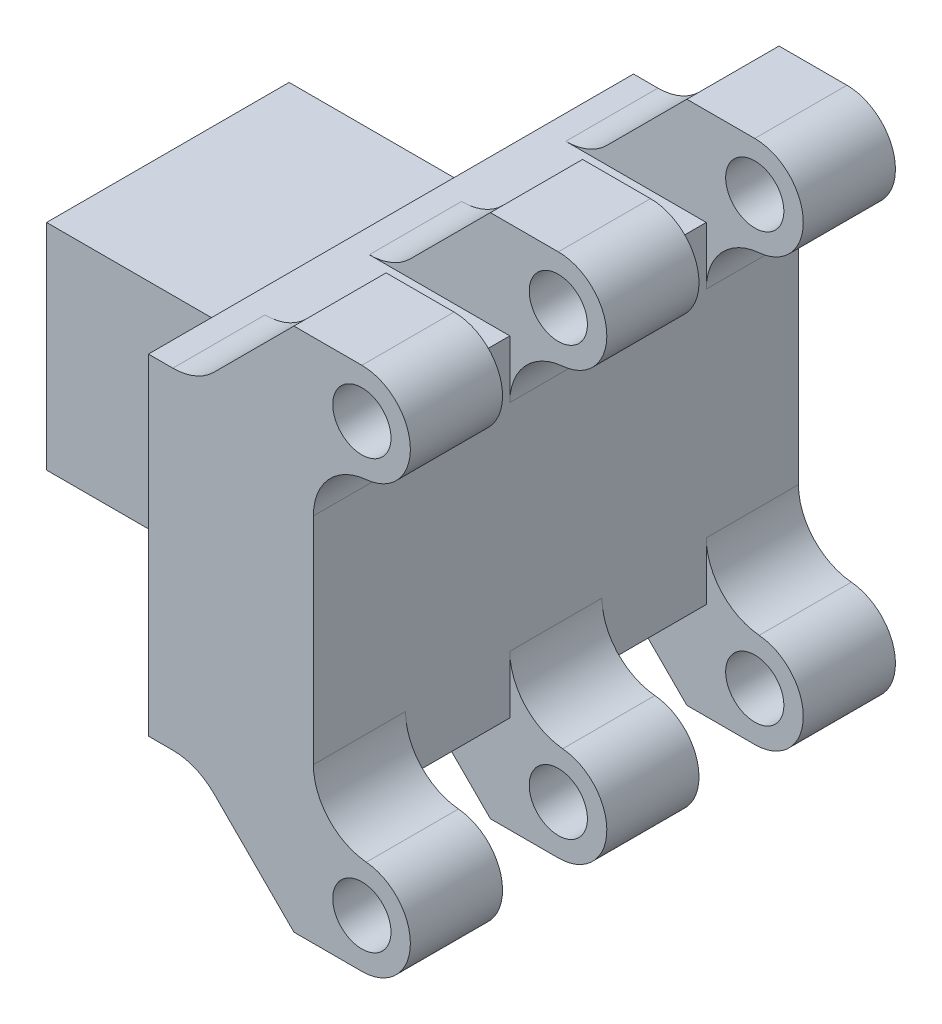
from build123d import *

# Parameters (mm, degrees)
SKETCH1_W               = 50
SKETCH1_H               = 34.11
BOSS_EXTRUDE1_DEPTH     = 20
SKETCH2_R               = 3
BOSS_EXTRUDE2_DEPTH     = 9.5
LPATTERN1_COUNT         = 3
LPATTERN1_PITCH         = 20.25
MIRROR1_COPY_1_SKETCH_R = 3
MIRROR1_COPY_1_DEPTH    = 9.5
MIRROR1_COPY_2_SKETCH_R = 3
MIRROR1_COPY_2_DEPTH    = 9.5
SKETCH3_R               = 8
SKETCH3_W               = 3
SKETCH3_H               = 30
CUT_EXTRUDE1_DEPTH      = 10
SKETCH4_W               = 42
SKETCH4_H               = 22.11
CUT_EXTRUDE2_DEPTH      = 3
FILLET1_R               = 6
FILLET2_R               = 6
BOSS_EXTRUDE3_START     = 20
SKETCH5_W               = 25
SKETCH5_H               = 22.11
SKETCH5_R               = 8
BOSS_EXTRUDE3_DEPTH     = 20


with BuildPart() as part:
    # Sketch1 → Boss-Extrude1 (new body)
    with BuildSketch(Plane(origin=(0, 0, 0), x_dir=(0, 0, -1), z_dir=(1, 0, 0))):
        with Locations((25, 17.055)):
            Rectangle(SKETCH1_W, SKETCH1_H)
    extrude(amount=BOSS_EXTRUDE1_DEPTH)

    # Sketch2 → Boss-Extrude2 (add)
    with BuildSketch(Plane.XY):
        with BuildLine():
            Line((20, 34.11), (25, 34.11))
            ThreePointArc((25, 34.11), (30, 39.11), (25, 44.11))
            Line((25, 44.11), (18, 44.11))
            Line((18, 44.11), (8, 34.11))
            Line((8, 34.11), (20, 34.11))
        make_face()
        with Locations((25, 39.11)):
            Circle(SKETCH2_R, mode=Mode.SUBTRACT)
    boss_extrude2 = extrude(amount=-BOSS_EXTRUDE2_DEPTH)

    # LPattern1: Boss-Extrude2 ×3
    with Locations(*[(0, 0, -i * LPATTERN1_PITCH) for i in range(1, LPATTERN1_COUNT)]):
        add(boss_extrude2)

    # Mirror1: Boss-Extrude2 across plane
    add(boss_extrude2.mirror(Plane.ZX.offset(17.055)))

    # Mirror1 copy 1 sketch → Mirror1 copy 1 (add)
    with BuildSketch(Plane(origin=(0, 34.11, -20.25), x_dir=(1, 0, 0), z_dir=(0, 0, 1))):
        with BuildLine():
            Line((20, -34.11), (25, -34.11))
            ThreePointArc((25, -34.11), (30, -39.11), (25, -44.11))
            Line((25, -44.11), (18, -44.11))
            Line((18, -44.11), (8, -34.11))
            Line((8, -34.11), (20, -34.11))
        make_face()
        with Locations((25, -39.11)):
            Circle(MIRROR1_COPY_1_SKETCH_R, mode=Mode.SUBTRACT)
    extrude(amount=-MIRROR1_COPY_1_DEPTH)

    # Mirror1 copy 2 sketch → Mirror1 copy 2 (add)
    with BuildSketch(Plane(origin=(0, 34.11, -40.5), x_dir=(1, 0, 0), z_dir=(0, 0, 1))):
        with BuildLine():
            Line((20, -34.11), (25, -34.11))
            ThreePointArc((25, -34.11), (30, -39.11), (25, -44.11))
            Line((25, -44.11), (18, -44.11))
            Line((18, -44.11), (8, -34.11))
            Line((8, -34.11), (20, -34.11))
        make_face()
        with Locations((25, -39.11)):
            Circle(MIRROR1_COPY_2_SKETCH_R, mode=Mode.SUBTRACT)
    extrude(amount=-MIRROR1_COPY_2_DEPTH)

    # Sketch3 → Cut-Extrude1 (cut)
    with BuildSketch(Plane.ZY):
        with Locations((-25, 17.055)):
            Circle(SKETCH3_R)
        with Locations((-39, 17.055)):
            Rectangle(SKETCH3_W, SKETCH3_H)
        with Locations((-11, 17.055)):
            Rectangle(SKETCH3_W, SKETCH3_H)
    extrude(amount=-CUT_EXTRUDE1_DEPTH, mode=Mode.SUBTRACT)

    # Sketch4 → Cut-Extrude2 (cut)
    with BuildSketch(Plane(origin=(0, 0, 0), x_dir=(0, 0, -1), z_dir=(1, 0, 0))):
        Polygon((50, 34.11), (0, 34.11), (0, 28.11), (0, 6), (0, 0), (50, 0), (50, 6), (50, 28.11), align=None)
        with Locations((25, 17.055)):
            Rectangle(SKETCH4_W, SKETCH4_H, mode=Mode.SUBTRACT)
    extrude(amount=CUT_EXTRUDE2_DEPTH, mode=Mode.SUBTRACT)

    # Fillet1
    # the kernel refuses this fillet: 6 mm, written as the material it adds along each edge
    with BuildSketch(Plane(origin=(20, 0, -25.613872125), x_dir=(0, 1, 0), z_dir=(0, 0, -1))) as fillet1_piece_1_section:
        with BuildLine():
            CenterArc((5.95445115, 6), FILLET1_R, 185.21590857, 84.78409143)
            Line((-0.020704023, 5.454545455), (-0.61821954, 5.4))
            ThreePointArc((-0.61821954, 5.4), (-0.6, 5), (-0.6, 0))
            Line((-0.6, 0), (0, -0.6))
            Line((0, -0.6), (5.95445115, -0.6))
            Line((5.95445115, -0.6), (5.95445115, 0))
        make_face()
    fillet1_piece_1 = extrude(amount=39.272255751, mode=Mode.PRIVATE)
    fillet1_piece_1 = split(fillet1_piece_1, bisect_by=Plane(origin=(21.495039794, 1.973310918, -29.75), z_dir=(0, 0, 1)), keep=Keep.TOP, mode=Mode.PRIVATE)
    add(fillet1_piece_1)
    with BuildSketch(Plane(origin=(20, 0, -40.5), x_dir=(0, 1, 0), z_dir=(0, 0, -1)), Plane(origin=(20, 0, -20.25), x_dir=(0, 1, 0), z_dir=(0, 0, -1)), Plane(origin=(20, 0, 0), x_dir=(0, 1, 0), z_dir=(0, 0, -1)), Plane(origin=(20, 34.11, -50), x_dir=(0, -1, 0), z_dir=(0, 0, 1)), Plane(origin=(20, 34.11, -29.75), x_dir=(0, -1, 0), z_dir=(0, 0, 1)), Plane(origin=(20, 34.11, -9.5), x_dir=(0, -1, 0), z_dir=(0, 0, 1))) as fillet1_piece_2:
        with BuildLine():
            CenterArc((5.95445115, 6), FILLET1_R, 185.21590857, 84.78409143)
            Line((-0.020704023, 5.454545455), (-0.61821954, 5.4))
            ThreePointArc((-0.61821954, 5.4), (-0.6, 5), (-0.6, 0))
            Line((-0.6, 0), (0, -0.6))
            Line((0, -0.6), (5.95445115, -0.6))
            Line((5.95445115, -0.6), (5.95445115, 0))
        make_face()
    extrude(amount=9.5)
    with BuildSketch(Plane(origin=(20, 0, -5.363872125), x_dir=(0, 1, 0), z_dir=(0, 0, -1))) as fillet1_piece_3_section:
        with BuildLine():
            CenterArc((5.95445115, 6), FILLET1_R, 185.21590857, 84.78409143)
            Line((-0.020704023, 5.454545455), (-0.61821954, 5.4))
            ThreePointArc((-0.61821954, 5.4), (-0.6, 5), (-0.6, 0))
            Line((-0.6, 0), (0, -0.6))
            Line((0, -0.6), (5.95445115, -0.6))
            Line((5.95445115, -0.6), (5.95445115, 0))
        make_face()
    fillet1_piece_3 = extrude(amount=39.272255751, mode=Mode.PRIVATE)
    fillet1_piece_3 = split(fillet1_piece_3, bisect_by=Plane(origin=(21.495039794, 1.973310918, -9.5), z_dir=(0, 0, 1)), keep=Keep.TOP, mode=Mode.PRIVATE)
    add(fillet1_piece_3)
    with BuildSketch(Plane(origin=(20, 0, -5.363872125), x_dir=(0, 1, 0), z_dir=(0, 0, -1))) as fillet1_piece_4_section:
        with BuildLine():
            CenterArc((5.95445115, 6), FILLET1_R, 185.21590857, 84.78409143)
            Line((-0.020704023, 5.454545455), (-0.61821954, 5.4))
            ThreePointArc((-0.61821954, 5.4), (-0.6, 5), (-0.6, 0))
            Line((-0.6, 0), (0, -0.6))
            Line((0, -0.6), (5.95445115, -0.6))
            Line((5.95445115, -0.6), (5.95445115, 0))
        make_face()
    fillet1_piece_4 = extrude(amount=39.272255751, mode=Mode.PRIVATE)
    fillet1_piece_4 = split(fillet1_piece_4, bisect_by=Plane(origin=(21.495039794, 1.973310918, -40.5), z_dir=(0, 0, -1)), keep=Keep.TOP, mode=Mode.PRIVATE)
    add(fillet1_piece_4)
    with BuildSketch(Plane(origin=(20, 0, 14.886127875), x_dir=(0, 1, 0), z_dir=(0, 0, -1))) as fillet1_piece_5_section:
        with BuildLine():
            CenterArc((5.95445115, 6), FILLET1_R, 185.21590857, 84.78409143)
            Line((-0.020704023, 5.454545455), (-0.61821954, 5.4))
            ThreePointArc((-0.61821954, 5.4), (-0.6, 5), (-0.6, 0))
            Line((-0.6, 0), (0, -0.6))
            Line((0, -0.6), (5.95445115, -0.6))
            Line((5.95445115, -0.6), (5.95445115, 0))
        make_face()
    fillet1_piece_5 = extrude(amount=39.272255751, mode=Mode.PRIVATE)
    fillet1_piece_5 = split(fillet1_piece_5, bisect_by=Plane(origin=(21.495039794, 1.973310918, -20.25), z_dir=(0, 0, -1)), keep=Keep.TOP, mode=Mode.PRIVATE)
    add(fillet1_piece_5)
    with BuildSketch(Plane(origin=(20, 34.11, -64.886127875), x_dir=(0, -1, 0), z_dir=(0, 0, 1))) as fillet1_piece_6_section:
        with BuildLine():
            CenterArc((5.95445115, 6), FILLET1_R, 185.21590857, 84.78409143)
            Line((-0.020704023, 5.454545455), (-0.61821954, 5.4))
            ThreePointArc((-0.61821954, 5.4), (-0.6, 5), (-0.6, 0))
            Line((-0.6, 0), (0, -0.6))
            Line((0, -0.6), (5.95445115, -0.6))
            Line((5.95445115, -0.6), (5.95445115, 0))
        make_face()
    fillet1_piece_6 = extrude(amount=39.272255751, mode=Mode.PRIVATE)
    fillet1_piece_6 = split(fillet1_piece_6, bisect_by=Plane(origin=(21.495039794, 32.136689082, -29.75), z_dir=(0, 0, 1)), keep=Keep.TOP, mode=Mode.PRIVATE)
    add(fillet1_piece_6)
    with BuildSketch(Plane(origin=(20, 34.11, -44.636127875), x_dir=(0, -1, 0), z_dir=(0, 0, 1))) as fillet1_piece_7_section:
        with BuildLine():
            CenterArc((5.95445115, 6), FILLET1_R, 185.21590857, 84.78409143)
            Line((-0.020704023, 5.454545455), (-0.61821954, 5.4))
            ThreePointArc((-0.61821954, 5.4), (-0.6, 5), (-0.6, 0))
            Line((-0.6, 0), (0, -0.6))
            Line((0, -0.6), (5.95445115, -0.6))
            Line((5.95445115, -0.6), (5.95445115, 0))
        make_face()
    fillet1_piece_7 = extrude(amount=39.272255751, mode=Mode.PRIVATE)
    fillet1_piece_7 = split(fillet1_piece_7, bisect_by=Plane(origin=(21.495039794, 32.136689082, -40.5), z_dir=(0, 0, -1)), keep=Keep.TOP, mode=Mode.PRIVATE)
    add(fillet1_piece_7)
    with BuildSketch(Plane(origin=(20, 34.11, -44.636127875), x_dir=(0, -1, 0), z_dir=(0, 0, 1))) as fillet1_piece_8_section:
        with BuildLine():
            CenterArc((5.95445115, 6), FILLET1_R, 185.21590857, 84.78409143)
            Line((-0.020704023, 5.454545455), (-0.61821954, 5.4))
            ThreePointArc((-0.61821954, 5.4), (-0.6, 5), (-0.6, 0))
            Line((-0.6, 0), (0, -0.6))
            Line((0, -0.6), (5.95445115, -0.6))
            Line((5.95445115, -0.6), (5.95445115, 0))
        make_face()
    fillet1_piece_8 = extrude(amount=39.272255751, mode=Mode.PRIVATE)
    fillet1_piece_8 = split(fillet1_piece_8, bisect_by=Plane(origin=(21.495039794, 32.136689082, -9.5), z_dir=(0, 0, 1)), keep=Keep.TOP, mode=Mode.PRIVATE)
    add(fillet1_piece_8)
    with BuildSketch(Plane(origin=(20, 34.11, -24.386127875), x_dir=(0, -1, 0), z_dir=(0, 0, 1))) as fillet1_piece_9_section:
        with BuildLine():
            CenterArc((5.95445115, 6), FILLET1_R, 185.21590857, 84.78409143)
            Line((-0.020704023, 5.454545455), (-0.61821954, 5.4))
            ThreePointArc((-0.61821954, 5.4), (-0.6, 5), (-0.6, 0))
            Line((-0.6, 0), (0, -0.6))
            Line((0, -0.6), (5.95445115, -0.6))
            Line((5.95445115, -0.6), (5.95445115, 0))
        make_face()
    fillet1_piece_9 = extrude(amount=39.272255751, mode=Mode.PRIVATE)
    fillet1_piece_9 = split(fillet1_piece_9, bisect_by=Plane(origin=(21.495039794, 32.136689082, -20.25), z_dir=(0, 0, -1)), keep=Keep.TOP, mode=Mode.PRIVATE)
    add(fillet1_piece_9)

    # Fillet2
    fillet2_edges = [part.edges().sort_by_distance(p)[0] for p in [
        (8, 0, -45.25),
        (8, 34.11, -4.75),
        (8, 34.11, -25),
        (8, 34.11, -45.25),
        (8, 0, -4.75),
        (8, 0, -25),
    ]]
    fillet(fillet2_edges, radius=FILLET2_R)

    # Sketch5 → Boss-Extrude3 (add)
    with BuildSketch(Plane.ZY.offset(BOSS_EXTRUDE3_START)):
        with Locations((-25, 17.055)):
            Rectangle(SKETCH5_W, SKETCH5_H)
        with Locations((-25, 17.055)):
            Circle(SKETCH5_R, mode=Mode.SUBTRACT)
    extrude(amount=-BOSS_EXTRUDE3_DEPTH)


solid = part.part
